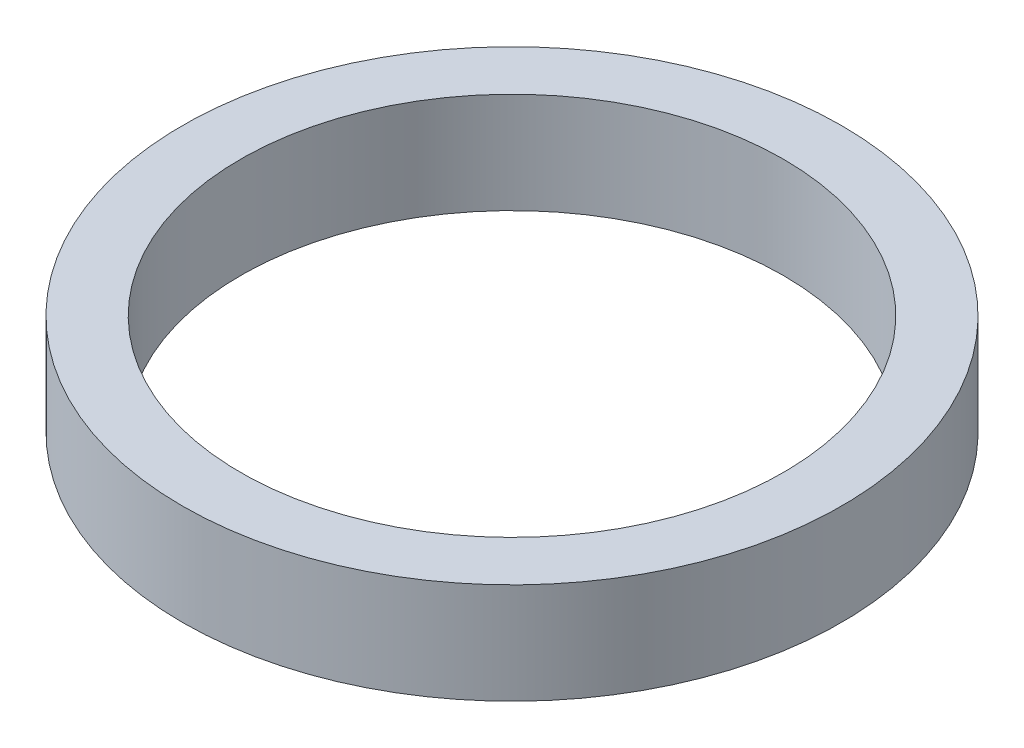
from build123d import *

# Parameters (mm, degrees)
SKETCH1_R           = 42.5
BOSS_EXTRUDE1_DEPTH = 13
SKETCH2_R           = 35
CUT_EXTRUDE1_DEPTH  = 62.493902137


with BuildPart() as part:
    # Sketch1 → Boss-Extrude1 (new body)
    with BuildSketch(Plane(origin=(0, 0, 0), x_dir=(1, 0, 0), z_dir=(0, 1, 0))):
        Circle(SKETCH1_R)
    extrude(amount=BOSS_EXTRUDE1_DEPTH)

    # Sketch2 → Cut-Extrude1 (cut, through all)
    with BuildSketch(Plane(origin=(0, 0, 0), x_dir=(1, 0, 0), z_dir=(0, 1, 0))):
        Circle(SKETCH2_R)
    extrude(amount=CUT_EXTRUDE1_DEPTH, mode=Mode.SUBTRACT)


solid = part.part
